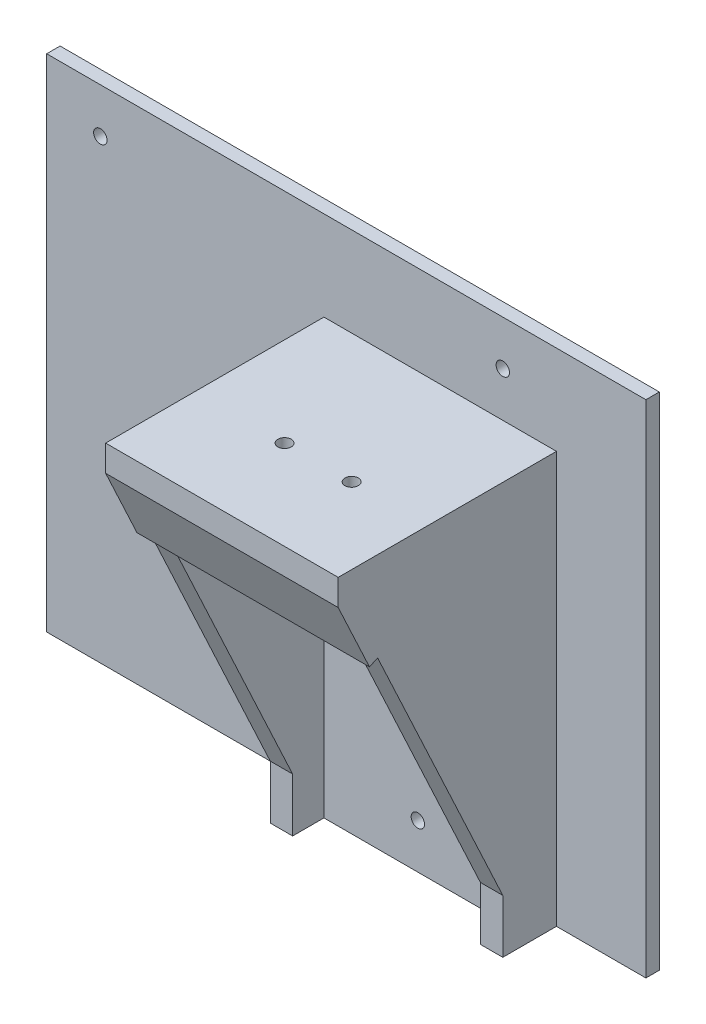
from build123d import *

# Parameters (mm, degrees)
CROQUIS1_W              = 134
CROQUIS1_H              = 112
SALIENTE_EXTRUIR1_DEPTH = 3
CROQUIS2_W              = 52
CROQUIS2_H              = 92
SALIENTE_EXTRUIR2_DEPTH = 48.812
CORTAR_EXTRUIR1_DEPTH   = 105.902256144
VACIADO1_DEPTH          = 42
CROQUIS4_W              = 52
CROQUIS4_H              = 5
SALIENTE_EXTRUIR3_DEPTH = 90
CROQUIS5_R              = 1.5
CORTAR_EXTRUIR2_DEPTH   = 90
CROQUIS6_R              = 1.5
CORTAR_EXTRUIR3_DEPTH   = 90


# Read off the part's stored shape, not the designer's step: Vaciado1
with BuildPart() as part:
    # Croquis1 → Saliente-Extruir1 (new body)
    with BuildSketch(Plane.XY):
        Rectangle(CROQUIS1_W, CROQUIS1_H)
    extrude(amount=SALIENTE_EXTRUIR1_DEPTH)

    # Croquis2 → Saliente-Extruir2 (add)
    with BuildSketch(Plane.XY.offset(3)):
        with Locations((21, -10)):
            Rectangle(CROQUIS2_W, CROQUIS2_H)
    extrude(amount=SALIENTE_EXTRUIR2_DEPTH)

    # Croquis3 → Cortar-Extruir1 (cut, through all)
    with BuildSketch(Plane.ZY.offset(5)):
        Polygon((51.812, -56), (51.812, 30.154), (44.811949005, 15.153963498), (43.00020398, 16.000146009), (15, -44), (15, -56), align=None)
    extrude(amount=-CORTAR_EXTRUIR1_DEPTH, mode=Mode.SUBTRACT)

    # Vaciado1 outline → Vaciado1 (cut)
    with BuildSketch(Plane.YZ):
        Polygon((-56, 5), (31, 5), (31, 46.812), (19.738299384, 46.812), (20.531058004, 45.114639836), (16.000146009, 43.00020398), (-44, 15), (-56, 15), align=None)
    extrude(amount=VACIADO1_DEPTH, mode=Mode.SUBTRACT)

    # Croquis4 → Saliente-Extruir3 (add)
    with BuildSketch(Plane.XZ.offset(56)):
        with Locations((21, 5.5)):
            Rectangle(CROQUIS4_W, CROQUIS4_H)
    extrude(amount=-SALIENTE_EXTRUIR3_DEPTH)

    # Croquis5 → Cortar-Extruir2 (cut)
    with BuildSketch(Plane.XY.offset(8)):
        with Locations((21, -46)):
            Circle(CROQUIS5_R)
        with Locations((-55, 46)):
            Circle(CROQUIS5_R)
        with Locations((35, 46)):
            Circle(CROQUIS5_R)
    extrude(amount=-CORTAR_EXTRUIR2_DEPTH, mode=Mode.SUBTRACT)

    # Croquis6 → Cortar-Extruir3 (cut)
    with BuildSketch(Plane(origin=(0, 36, 0), x_dir=(1, 0, 0), z_dir=(0, 1, 0))):
        with Locations(Location((30, -31.812, 0), (0, 0, 270))):
            Circle(CROQUIS6_R)
        with Locations(Location((15, -31.812, 0), (0, 0, 270))):
            Circle(CROQUIS6_R)
    extrude(amount=-CORTAR_EXTRUIR3_DEPTH, mode=Mode.SUBTRACT)


solid = part.part
